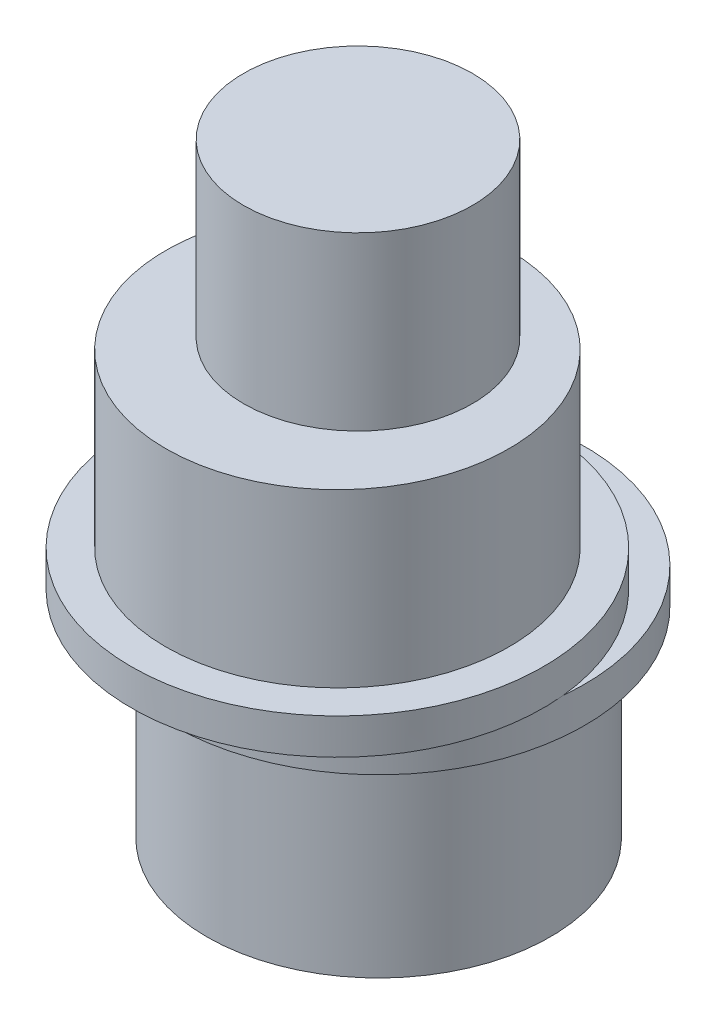
from build123d import *

# Parameters (mm, degrees)
SKETCH1_R               = 6
BOSS_EXTRUDE1_DEPTH     = 7
SKETCH2_R               = 7.2
BOSS_EXTRUDE2_DEPTH     = 1.25
SKETCH3_R               = 7.2
BOSS_EXTRUDE3_DEPTH     = 1.25
SKETCH4_R               = 6
BOSS_EXTRUDE4_DEPTH     = 6
CUT_EXTRUDE2_DEPTH      = 19.836570813
CUT_EXTRUDE2_DEPTH_BACK = 11
SKETCH6_R               = 4
BOSS_EXTRUDE5_DEPTH     = 6


with BuildPart() as part:
    # Sketch1 → Boss-Extrude1 (new body)
    with BuildSketch(Plane(origin=(0, 0, 0), x_dir=(1, 0, 0), z_dir=(0, 1, 0))):
        with Locations((0, 0.72)):
            Circle(SKETCH1_R)
    extrude(amount=BOSS_EXTRUDE1_DEPTH)

    # Sketch2 → Boss-Extrude2 (add)
    with BuildSketch(Plane(origin=(0, 7, 0), x_dir=(1, 0, 0), z_dir=(0, 1, 0))):
        with Locations((0, 0.72)):
            Circle(SKETCH2_R)
    extrude(amount=BOSS_EXTRUDE2_DEPTH)

    # Sketch3 → Boss-Extrude3 (add)
    with BuildSketch(Plane(origin=(0, 8.25, 0), x_dir=(1, 0, 0), z_dir=(0, 1, 0))):
        with Locations((0, -0.72)):
            Circle(SKETCH3_R)
    extrude(amount=BOSS_EXTRUDE3_DEPTH)

    # Sketch4 → Boss-Extrude4 (add)
    with BuildSketch(Plane(origin=(0, 9.5, 0), x_dir=(1, 0, 0), z_dir=(0, 1, 0))):
        with Locations((0, -0.72)):
            Circle(SKETCH4_R)
    extrude(amount=BOSS_EXTRUDE4_DEPTH)

    # Sketch5 → Cut-Extrude2 (cut, two sides: drawn at the far end of the back side and taken through both)
    with BuildSketch(Plane.XZ.offset(-CUT_EXTRUDE2_DEPTH_BACK)):
        with BuildLine():
            Line((1.506029548, 2.15), (-1.506029548, 2.15))
            ThreePointArc((-1.506029548, 2.15), (0, -2.625), (1.506029548, 2.15))
        make_face()
    extrude(amount=CUT_EXTRUDE2_DEPTH + CUT_EXTRUDE2_DEPTH_BACK, mode=Mode.SUBTRACT)

    # Sketch6 → Boss-Extrude5 (add)
    with BuildSketch(Plane(origin=(0, 15.5, 0), x_dir=(1, 0, 0), z_dir=(0, 1, 0))):
        Circle(SKETCH6_R)
    extrude(amount=BOSS_EXTRUDE5_DEPTH)


solid = part.part
